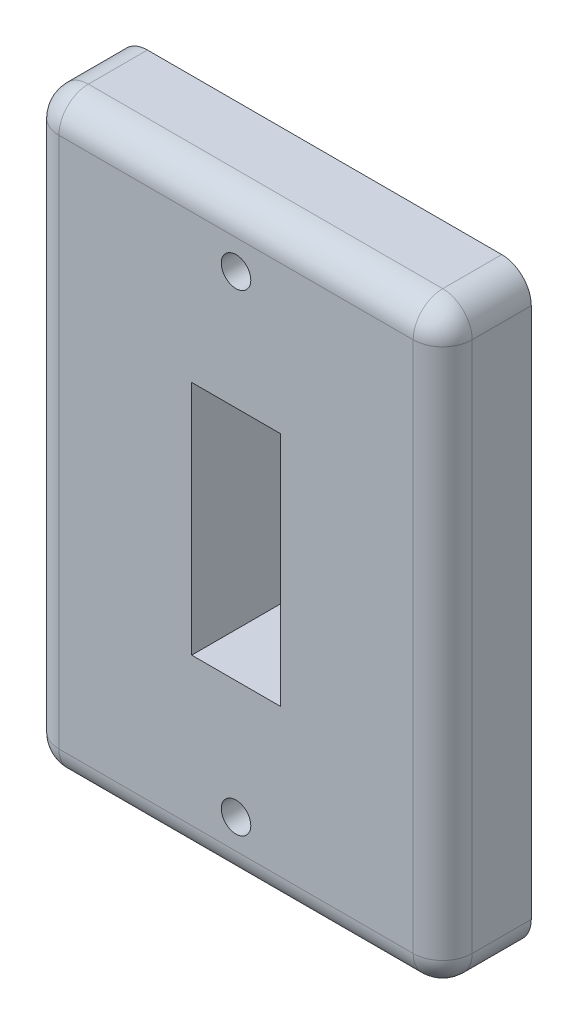
from build123d import *

# Parameters (mm, degrees)
SKETCH1_W           = 70
SKETCH1_H           = 100
BOSS_EXTRUDE1_DEPTH = 15
SKETCH3_W           = 15
SKETCH3_H           = 40
CUT_EXTRUDE1_DEPTH  = 63.84902545
SKETCH4_R           = 2.5
CUT_EXTRUDE2_DEPTH  = 63.84902545
FILLET1_R           = 5
BOSS_EXTRUDE2_START = -2
SKETCH5_R           = 2.5
SKETCH5_R_2         = 1
BOSS_EXTRUDE2_DEPTH = 2
FILLET2_R           = 5


with BuildPart() as part:
    # Sketch1 → Boss-Extrude1 (new body)
    with BuildSketch(Plane.XY):
        Rectangle(SKETCH1_W, SKETCH1_H)
    extrude(amount=BOSS_EXTRUDE1_DEPTH)

    # Sketch3 → Cut-Extrude1 (cut, through all)
    with BuildSketch(Plane.XY.offset(15)):
        Rectangle(SKETCH3_W, SKETCH3_H)
    extrude(amount=-CUT_EXTRUDE1_DEPTH, mode=Mode.SUBTRACT)

    # Sketch4 → Cut-Extrude2 (cut, through all)
    with BuildSketch(Plane.XY.offset(15)):
        with Locations((0, -40)):
            Circle(SKETCH4_R)
        with Locations((0, 40)):
            Circle(SKETCH4_R)
    extrude(amount=-CUT_EXTRUDE2_DEPTH, mode=Mode.SUBTRACT)

    # Fillet1
    fillet1_edges = [part.edges().sort_by_distance(p)[0] for p in [
        (-35, 0, 15),
        (0, -50, 15),
        (35, 0, 15),
        (0, 50, 15),
    ]]
    fillet(fillet1_edges, radius=FILLET1_R)

    # Sketch5 → Boss-Extrude2 (add)
    # profile 1 of 2: a face of its own
    with BuildSketch(Plane(origin=(0, 0, 0), x_dir=(-1, 0, 0), z_dir=(0, 0, -1)).offset(BOSS_EXTRUDE2_START)):
        with Locations(Location((0, 40, 0), (0, 0, 180))):
            Circle(SKETCH5_R)
        with Locations((0, 40)):
            Circle(SKETCH5_R_2, mode=Mode.SUBTRACT)
    # profile 2 of 2: a face of its own
    with BuildSketch(Plane(origin=(0, 0, 0), x_dir=(-1, 0, 0), z_dir=(0, 0, -1)).offset(BOSS_EXTRUDE2_START)):
        with Locations(Location((0, -40, 0), (0, 0, 180))):
            Circle(SKETCH5_R)
        with Locations((0, -40)):
            Circle(SKETCH5_R_2, mode=Mode.SUBTRACT)
    extrude(amount=BOSS_EXTRUDE2_DEPTH)

    # Fillet2
    # the kernel refuses this fillet: 5 mm, written as the material it takes off along each edge
    with BuildSketch(Plane(origin=(-30, 45, 10), x_dir=(0, 1, 0), z_dir=(-1, 0, 0))) as fillet2_piece_1_section:
        Polygon((0, 0), (FILLET2_R, 0), (FILLET2_R, -FILLET2_R), (0, -FILLET2_R), align=None)
    fillet2_piece_1 = extrude(amount=FILLET2_R, mode=Mode.PRIVATE)
    fillet2_piece_1 = fillet2_piece_1 - Plane(origin=(-30, 45, 10), x_dir=(0, -0.7071067811865475, -0.7071067811865475), z_dir=(-1, 0, 0)) * Sphere(FILLET2_R, mode=Mode.PRIVATE)
    add(fillet2_piece_1, mode=Mode.SUBTRACT)
    with BuildSketch(Plane(origin=(30, 45, 10), x_dir=(0, 1, 0), z_dir=(1, 0, 0))) as fillet2_piece_2_section:
        Polygon((0, 0), (FILLET2_R, 0), (FILLET2_R, FILLET2_R), (0, FILLET2_R), align=None)
    fillet2_piece_2 = extrude(amount=FILLET2_R, mode=Mode.PRIVATE)
    fillet2_piece_2 = fillet2_piece_2 - Plane(origin=(30, 45, 10), x_dir=(0, -0.7071067811865475, -0.7071067811865475), z_dir=(1, 0, 0)) * Sphere(FILLET2_R, mode=Mode.PRIVATE)
    add(fillet2_piece_2, mode=Mode.SUBTRACT)
    with BuildSketch(Plane(origin=(-30, -45, 10), x_dir=(-1, 0, 0), z_dir=(0, -1, 0))) as fillet2_piece_3_section:
        Polygon((0, 0), (FILLET2_R, 0), (FILLET2_R, -FILLET2_R), (0, -FILLET2_R), align=None)
    fillet2_piece_3 = extrude(amount=FILLET2_R, mode=Mode.PRIVATE)
    fillet2_piece_3 = fillet2_piece_3 - Plane(origin=(-30, -45, 10), x_dir=(0.7071067811865475, 0, -0.7071067811865475), z_dir=(0, -1, 0)) * Sphere(FILLET2_R, mode=Mode.PRIVATE)
    add(fillet2_piece_3, mode=Mode.SUBTRACT)
    with BuildSketch(Plane(origin=(30, -45, 10), x_dir=(1, 0, 0), z_dir=(0, -1, 0))) as fillet2_piece_4_section:
        Polygon((0, 0), (FILLET2_R, 0), (FILLET2_R, FILLET2_R), (0, FILLET2_R), align=None)
    fillet2_piece_4 = extrude(amount=FILLET2_R, mode=Mode.PRIVATE)
    fillet2_piece_4 = fillet2_piece_4 - Plane(origin=(30, -45, 10), x_dir=(-0.7071067811865475, 0, -0.7071067811865475), z_dir=(0, -1, 0)) * Sphere(FILLET2_R, mode=Mode.PRIVATE)
    add(fillet2_piece_4, mode=Mode.SUBTRACT)
    with BuildSketch(Plane(origin=(35, -50, -12.5), x_dir=(-1, 0, 0), z_dir=(0, 0, 1)), Plane(origin=(35, 50, -12.5), x_dir=(0, -1, 0), z_dir=(0, 0, 1))) as fillet2_piece_5:
        with BuildLine():
            CenterArc((FILLET2_R, -FILLET2_R), FILLET2_R, 90, 90)
            Line((0, -FILLET2_R), (0, 0))
            Line((0, 0), (FILLET2_R, 0))
        make_face()
    extrude(amount=22.5, mode=Mode.SUBTRACT)
    with BuildSketch(Plane(origin=(-35, -50, -12.5), x_dir=(1, 0, 0), z_dir=(0, 0, 1)), Plane(origin=(-35, 50, -12.5), x_dir=(0, -1, 0), z_dir=(0, 0, 1))) as fillet2_piece_6:
        with BuildLine():
            CenterArc((FILLET2_R, FILLET2_R), FILLET2_R, 180, 90)
            Line((0, FILLET2_R), (0, 0))
            Line((0, 0), (FILLET2_R, 0))
        make_face()
    extrude(amount=22.5, mode=Mode.SUBTRACT)


solid = part.part
